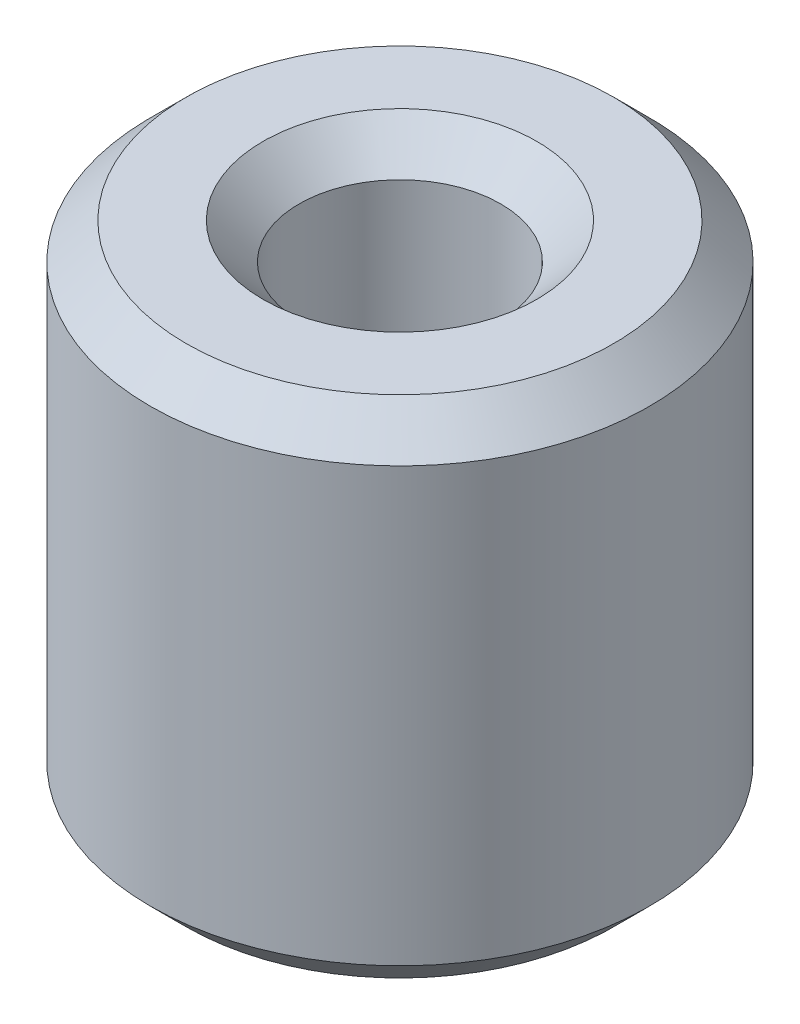
from build123d import *

# Parameters (mm, degrees)
SKETCH1_R           = 27.5
BOSS_EXTRUDE1_DEPTH = 55.629150171
SKETCH2_R           = 11.103368391
CUT_EXTRUDE1_DEPTH  = 68.875638846
CHAMFER1_SIZE       = 3.975478573


with BuildPart() as part:
    # Sketch1 → Boss-Extrude1 (new body)
    with BuildSketch(Plane(origin=(0, 0, 0), x_dir=(1, 0, 0), z_dir=(0, 1, 0))):
        Circle(SKETCH1_R)
    extrude(amount=BOSS_EXTRUDE1_DEPTH)

    # Sketch2 → Cut-Extrude1 (cut, through all)
    with BuildSketch(Plane(origin=(0, 0, 0), x_dir=(1, 0, 0), z_dir=(0, 1, 0))):
        Circle(SKETCH2_R)
    extrude(amount=CUT_EXTRUDE1_DEPTH, mode=Mode.SUBTRACT)

    # Chamfer1
    chamfer1_edges = [part.edges().sort_by_distance(p)[0] for p in [
        (-11.103368391, 55.629150171, 0),
        (-11.103368391, 0, 0),
        (-27.5, 0, 0),
        (-27.5, 55.629150171, 0),
    ]]
    chamfer(chamfer1_edges, length=CHAMFER1_SIZE)


solid = part.part
